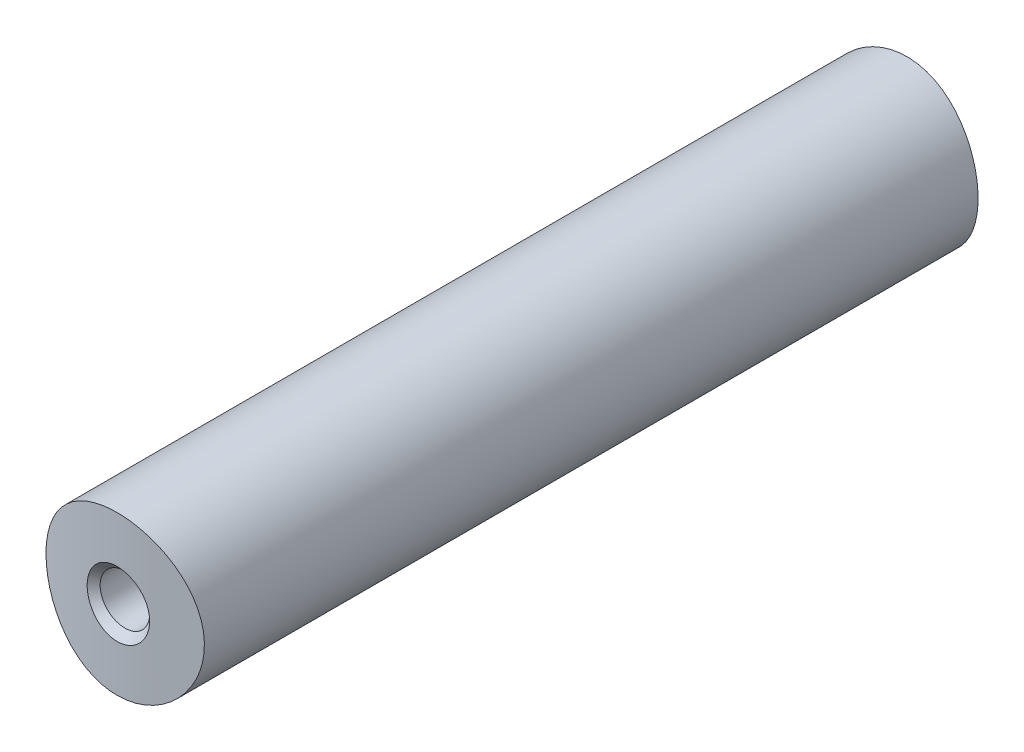
from build123d import *

# Parameters (mm, degrees)
SKETCH1_R      = 12.7
EXTRUDE1_DEPTH = 63.5
EXTRUDE2_START = -14
EXTRUDE2_DEPTH = 28


with BuildPart() as part:
    # Sketch1 → Extrude1 (new, symmetric)
    with BuildSketch(Plane.XY):
        Circle(SKETCH1_R)
    extrude(amount=EXTRUDE1_DEPTH, both=True)

    # Sketch4 → 3/8-16 Tapped Hole1 (revolve, cut)
    with BuildSketch(Plane(origin=(0, 0, 63.5), x_dir=(0, -1, 0), z_dir=(1, 0, 0))):
        Polygon((0, 0), (0, 27.784665582), (3.96875, 25.4), (3.96875, 1.42875), (5.3975, 0), align=None)
    f_3_8_16_tapped_hole1 = revolve(axis=Axis((0, 0, 69.85), (0, 0, -1)), mode=Mode.SUBTRACT)

    # Mirror1: 3/8-16 Tapped Hole1 across plane
    add(f_3_8_16_tapped_hole1.mirror(Plane.XY), mode=Mode.SUBTRACT)

    # Extrude2: read off the stored shape, not the designer's step
    # Extrude2 outline → Extrude2 (cut)
    with BuildSketch(Plane(origin=(0, 0, 0), x_dir=(1, 0, 0), z_dir=(0, 1, 0)).offset(EXTRUDE2_START)):
        with BuildLine():
            ThreePointArc((12.700884003, -62.02241801), (0.000451762, -63.309499998), (-12.699998846, -62.022599265))
            Line((-12.699998846, -62.022599265), (-14, -61.756405759))
            Line((-14, -61.756405759), (-14, -63.5))
            Line((-14, -63.5), (14, -63.5))
            Line((14, -63.5), (14, -61.756386435))
            Line((14, -61.756386435), (12.700884003, -62.02241801))
        make_face()
        with BuildLine():
            Line((-14, 63.5), (-14, 61.756405693))
            Line((-14, 61.756405693), (-12.700001857, 62.022598648))
            ThreePointArc((-12.700001857, 62.022598648), (0.000449638, 63.309499998), (12.700882852, 62.022418245))
            Line((12.700882852, 62.022418245), (14, 61.756386459))
            Line((14, 61.756386459), (14, 63.5))
            Line((14, 63.5), (-14, 63.5))
        make_face()
    extrude(amount=EXTRUDE2_DEPTH, mode=Mode.SUBTRACT)


solid = part.part
